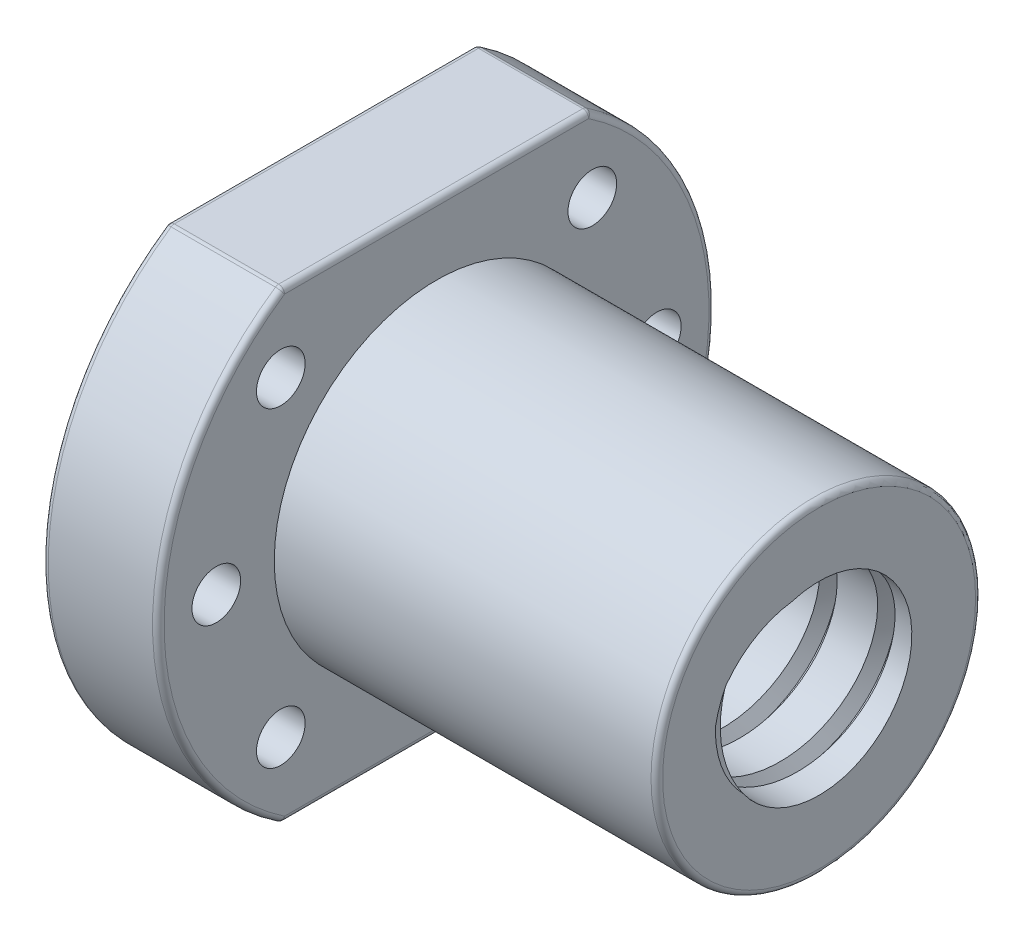
from build123d import *

# Parameters (mm, degrees)
CROQUIS1_R                 = 14
SALIENTE_EXTRUIR1_DEPTH    = 33
CROQUIS2_R                 = 24
SALIENTE_EXTRUIR2_DEPTH    = 10
CORTAR_EXTRUIR1_DEPTH      = 48.339201514
CORTAR_EXTRUIR1_DEPTH_BACK = 48.339201514
CROQUIS3_R                 = 8
CROQUIS4_W                 = 26.532998322
CROQUIS4_H                 = 8
CORTAR_EXTRUIR2_DEPTH      = 10
REDONDEO1_R                = 0.5
REDONDEO2_R                = 0.5
REDONDEO3_R                = 0.5
CROQUIS6_R                 = 2.1
CORTAR_EXTRUIR3_DEPTH      = 10
ROSCA1_PITCH               = 5


with BuildPart() as part:
    # Croquis1 → Saliente-Extruir1 (new body)
    with BuildSketch(Plane(origin=(0, 0, 0), x_dir=(0, 0, -1), z_dir=(1, 0, 0))):
        Circle(CROQUIS1_R)
    extrude(amount=SALIENTE_EXTRUIR1_DEPTH)

    # Croquis2 → Saliente-Extruir2 (add)
    with BuildSketch(Plane(origin=(0, 0, 0), x_dir=(0, 0, -1), z_dir=(1, 0, 0))):
        Circle(CROQUIS2_R)
    extrude(amount=-SALIENTE_EXTRUIR2_DEPTH)

    # Croquis3 → Cortar-Extruir1 (cut, two sides: drawn at the far end of the back side and taken through both)
    with BuildSketch(Plane(origin=(0, 0, 0), x_dir=(0, 0, -1), z_dir=(1, 0, 0)).offset(-CORTAR_EXTRUIR1_DEPTH_BACK)):
        Circle(CROQUIS3_R)
    extrude(amount=CORTAR_EXTRUIR1_DEPTH + CORTAR_EXTRUIR1_DEPTH_BACK, mode=Mode.SUBTRACT)

    # Croquis4 → Cortar-Extruir2 (cut)
    with BuildSketch(Plane(origin=(-10, 0, 0), x_dir=(0, 0, -1), z_dir=(1, 0, 0))):
        with Locations((0, 24)):
            Rectangle(CROQUIS4_W, CROQUIS4_H)
        Polygon((0, -20), (-13.266499161, -20), (-13.266499161, -28), (13.266499161, -28), (13.266499161, -20), align=None)
    extrude(amount=CORTAR_EXTRUIR2_DEPTH, mode=Mode.SUBTRACT)

    # Redondeo1
    redondeo1_edges = [part.edges().sort_by_distance(p)[0] for p in [
        (33, 0, 14),
    ]]
    fillet(redondeo1_edges, radius=REDONDEO1_R)

    # Redondeo2
    redondeo2_edges = [part.edges().sort_by_distance(p)[0] for p in [
        (0, 0, 24),
        (0, 0, -24),
        (-10, 0, 24),
        (-10, 0, -24),
        (-5, 20, -13.266499161),
        (-10, 20, 0),
        (0, 20, 0),
        (-10, -20, 0),
        (-5, -20, -13.266499161),
        (-5, -20, 13.266499161),
        (0, -20, 0),
    ]]
    fillet(redondeo2_edges, radius=REDONDEO2_R)

    # Redondeo3
    redondeo3_edges = [part.edges().sort_by_distance(p)[0] for p in [
        (-5, 20, 13.266499161),
        (-0.14255608, 19.849619571, 13.221080008),
        (-9.85744392, 19.849619571, 13.221080008),
    ]]
    fillet(redondeo3_edges, radius=REDONDEO3_R)

    # Croquis6 → Cortar-Extruir3 (cut)
    with BuildSketch(Plane(origin=(-10, 0, 0), x_dir=(0, 0, -1), z_dir=(1, 0, 0))):
        with Locations((13.435028843, 13.435028843)):
            Circle(CROQUIS6_R)
        with Locations((-13.435028843, 13.435028843)):
            Circle(CROQUIS6_R)
        with Locations((-13.435028843, -13.435028843)):
            Circle(CROQUIS6_R)
        with Locations((13.435028843, -13.435028843)):
            Circle(CROQUIS6_R)
        with Locations((19, 0)):
            Circle(CROQUIS6_R)
        with Locations((-19, 0)):
            Circle(CROQUIS6_R)
    extrude(amount=CORTAR_EXTRUIR3_DEPTH, mode=Mode.SUBTRACT)

    # Rosca1: the profile of Perfil de rosca1 profile screwed along a right-hand helix of 11 turns, 12 arcs to a turn; built about Z, then put on its axis
    rosca1_z = Axis((0, 0, 0), (0, 0, 1))
    rosca1_corners = [(7.9997, 3e-09, -0.000173205), (9.08253175, 4e-09, 0.624999997), (9.08253175, 4e-09, 0.874999997), (7.9997, 3e-09, 1.5001732)]
    with BuildLine(mode=Mode.PRIVATE) as rosca1_profile:
        Line(rosca1_corners[0], rosca1_corners[1])
        Line(rosca1_corners[1], rosca1_corners[2])
        Line(rosca1_corners[2], rosca1_corners[3])
        Line(rosca1_corners[3], rosca1_corners[0])
    rosca1_cap = Face(rosca1_profile.wire())
    rosca1_turn_angles = [0, 15, 30, 45, 60, 75, 90, 105, 120, 135, 150, 165, 180, 195, 210, 225, 240, 255, 270, 285, 300, 315, 330, 345, 360]
    rosca1_turn_weights = [1, 0.9659258262890683, 1, 0.9659258262890683, 1, 0.9659258262890683, 1, 0.9659258262890683, 1, 0.9659258262890683, 1, 0.9659258262890683, 1, 0.9659258262890683, 1, 0.9659258262890683, 1, 0.9659258262890683, 1, 0.9659258262890683, 1, 0.9659258262890683, 1, 0.9659258262890683, 1]
    rosca1_turn_rails = [Edge.make_bspline([Vector(p[0], p[1], 0).rotate(rosca1_z, rosca1_turn_angles[k]) / rosca1_turn_weights[k] + Vector(0, 0, p[2] + ROSCA1_PITCH * rosca1_turn_angles[k] / 360) for k in range(25)], [0, 0, 0, 1, 1, 2, 2, 3, 3, 4, 4, 5, 5, 6, 6, 7, 7, 8, 8, 9, 9, 10, 10, 11, 11, 12, 12, 12], 2, rosca1_turn_weights) for p in rosca1_corners]
    rosca1_turn_sides = [Face.make_surface_from_curves(rosca1_turn_rails[p[0]], rosca1_turn_rails[p[1]]) for p in [(0, 1), (1, 2), (2, 3), (3, 0)]]
    rosca1 = Plane(origin=(44, 0, 0), x_dir=(0, 0.017452406, 0.999847695), z_dir=(-1, 0, 0)) * Solid(Shell([*[p.moved(Location((0, 0, ROSCA1_PITCH * i))) for i in range(11) for p in rosca1_turn_sides], rosca1_cap, rosca1_cap.rotate(rosca1_z, 3960).moved(Location((0, 0, ROSCA1_PITCH * 3960 / 360)))]))
    add(rosca1, mode=Mode.SUBTRACT)


solid = part.part
